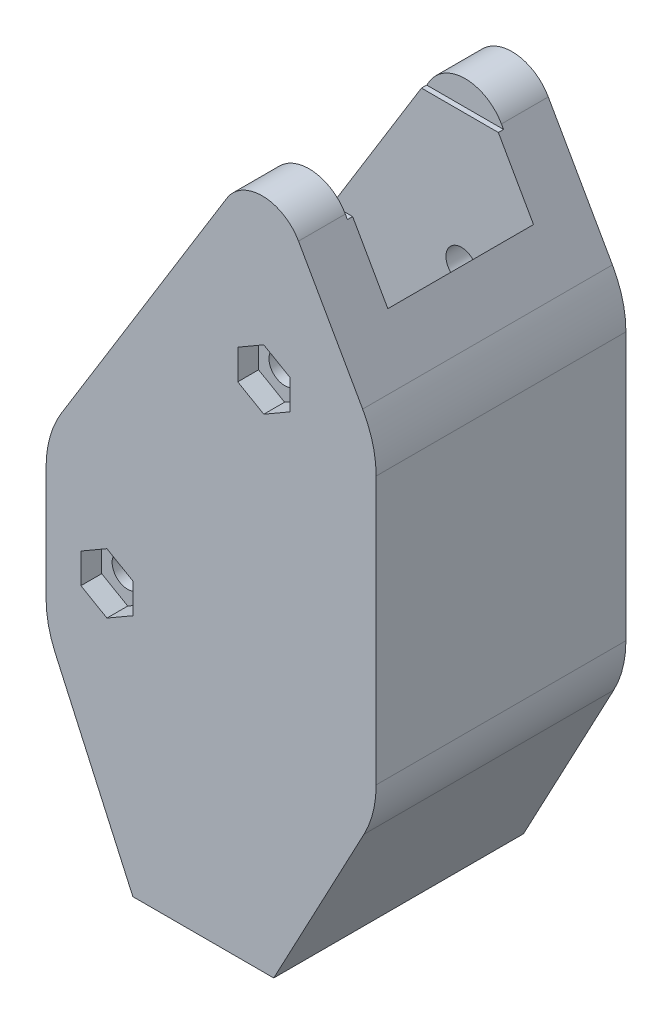
from build123d import *

# Parameters (mm, degrees)
SKETCH_1_W           = 41.838517058
SKETCH_1_H           = 61.659283987
SKETCH_1_R           = 1.5
EXTRUDE_1_DEPTH      = 24
SHELL_START          = 5
SHELL_2_OUTLINE_R    = 6.5
SHELL_2_DEPTH        = 14
SKETCH_7_W           = 14
SKETCH_7_H           = 61.659283987
CUT_EXTRUDE_2_DEPTH  = 38
SKETCH_11_W          = 14
SKETCH_11_H          = 61.659283987
EXTRUDE_2_DEPTH      = 14
SKETCH_12_W          = 10.1213772
SKETCH_12_H          = 61.659283987
CUT_EXTRUDE_3_DEPTH  = 52.896145639
CUT_EXTRUDE_5_DEPTH  = 47.819908548
SKETCH_18_W          = 15
SKETCH_18_H          = 18
CUT_EXTRUDE_6_DEPTH  = 54.011520411
EXTRUDE_5_DEPTH      = 24
SKETCH_22_W          = 27.838517058
SKETCH_22_H          = 14
CUT_EXTRUDE_8_DEPTH  = 17
SKETCH_23_W          = 14.991158549
SKETCH_23_H          = 11.73336261
EXTRUDE_8_DEPTH      = 2
FILLET_3_R           = 4
CUT_EXTRUDE_9_DEPTH  = 62.891048756
FILLET_4_R           = 4
FILLET_5_R           = 10
CUT_EXTRUDE_10_DEPTH = 2
SKETCH_26_R          = 2.5
CUT_EXTRUDE_11_DEPTH = 1


# Read off the part's stored shape, not the designer's step: 抽壳2
with BuildPart() as part:
    # 草图1 → 凸台-拉伸1 (new body)
    with BuildSketch(Plane.XY):
        with Locations((-8.896267572, -4.216675009)):
            Rectangle(SKETCH_1_W, SKETCH_1_H)
        with Locations((-8.896267572, -4.21667501)):
            Circle(SKETCH_1_R, mode=Mode.SUBTRACT)
        with Locations((6.176232993, -28.71667501)):
            Circle(SKETCH_1_R, mode=Mode.SUBTRACT)
    extrude(amount=EXTRUDE_1_DEPTH)

    # 抽壳2 outline → 抽壳2 (cut)
    # profile 1 of 2: a face of its own
    with BuildSketch(Plane.XY.offset(SHELL_START)):
        with BuildLine():
            Line((-24.815526101, 26.612966984), (-24.815526101, -35.046317003))
            Line((-24.815526101, -35.046317003), (4.697844602, -35.046317003))
            ThreePointArc((4.697844602, -35.046317003), (1.097738874, -24.659718332), (12.022990957, -25.876706469))
            Line((12.022990957, -25.876706469), (12.022990957, 26.612966984))
            Line((12.022990957, 26.612966984), (-24.815526101, 26.612966984))
        make_face()
        with Locations((-8.896267572, -4.21667501)):
            Circle(SHELL_2_OUTLINE_R, mode=Mode.SUBTRACT)
    # profile 2 of 2: a face of its own
    with BuildSketch(Plane.XY.offset(SHELL_START)):
        with BuildLine():
            ThreePointArc((12.022990957, -31.556643551), (10.23318967, -33.795169129), (7.654621384, -35.046317003))
            Line((7.654621384, -35.046317003), (12.022990957, -35.046317003))
            Line((12.022990957, -35.046317003), (12.022990957, -31.556643551))
        make_face()
    extrude(amount=SHELL_2_DEPTH, mode=Mode.SUBTRACT)

    # 草图7 → 切除-拉伸2 (cut)
    with BuildSketch(Plane(origin=(12.022990957, 0, 0), x_dir=(0, 0, -1), z_dir=(1, 0, 0))):
        with Locations((-12, -4.216675009)):
            Rectangle(SKETCH_7_W, SKETCH_7_H)
    extrude(amount=-CUT_EXTRUDE_2_DEPTH, mode=Mode.SUBTRACT)

    # 草图11 → 凸台-拉伸2 (add)
    with BuildSketch(Plane.ZY.offset(29.815526101)):
        with Locations((12, -4.216675009)):
            Rectangle(SKETCH_11_W, SKETCH_11_H)
    extrude(amount=-EXTRUDE_2_DEPTH)

    # 草图12 → 切除-拉伸3 (cut, through all)
    with BuildSketch(Plane.XY.offset(24)):
        with Locations((-24.754837501, -4.216675009)):
            Rectangle(SKETCH_12_W, SKETCH_12_H)
    extrude(amount=-CUT_EXTRUDE_3_DEPTH, mode=Mode.SUBTRACT)

    # 草图17 → 切除-拉伸5 (cut, through all)
    with BuildSketch(Plane.XY.offset(24)):
        Polygon((-8.896267572, 26.612966984), (-8.896267572, 14.867807771), (12.022990957, -19.135961659), (12.022990957, 26.612966984), align=None)
    extrude(amount=-CUT_EXTRUDE_5_DEPTH, mode=Mode.SUBTRACT)

    # 草图18 → 切除-拉伸6 (cut, through all)
    with BuildSketch(Plane.ZY.offset(19.694148901)):
        with Locations((12, 17.612966984)):
            Rectangle(SKETCH_18_W, SKETCH_18_H)
    extrude(amount=-CUT_EXTRUDE_6_DEPTH, mode=Mode.SUBTRACT)

    # 草图20 → 凸台-拉伸5 (add)
    with BuildSketch(Plane.XY.offset(24)):
        Polygon((-19.694148901, -35.046317003), (-9.853501275, -53.541034872), (3.683563025, -53.541034872), (12.022990957, -35.046317003), align=None)
    extrude(amount=-EXTRUDE_5_DEPTH)

    # 草图22 → 切除-拉伸8 (cut)
    with BuildSketch(Plane(origin=(0, -35.046317003, 0), x_dir=(1, 0, 0), z_dir=(0, 1, 0))):
        with Locations((-1.896267572, -12)):
            Rectangle(SKETCH_22_W, SKETCH_22_H)
    extrude(amount=-CUT_EXTRUDE_8_DEPTH, mode=Mode.SUBTRACT)

    # 草图23 → 凸台-拉伸8 (add)
    with BuildSketch(Plane(origin=(-29.881783728, -15.899464172, 0), x_dir=(0, 0, -1), z_dir=(0.8828123820911005, 0.469725768961675, 0))):
        with Locations((-11.904751729, -35.446570554)):
            Rectangle(SKETCH_23_W, SKETCH_23_H)
    extrude(amount=EXTRUDE_8_DEPTH)

    # 圆角3
    # the kernel refuses this fillet: 4 mm, written as the material it takes off along each edge
    with BuildSketch(Plane(origin=(-14.221722741, -41.073505124, 19), x_dir=(-0.8828123820904301, -0.4697257689629349, 0), z_dir=(0, 0, -1))) as fillet_3_piece_1:
        with BuildLine():
            CenterArc((4, -3.344189139), FILLET_3_R, 123.274953356, 56.725046644)
            Line((0, -3.344189139), (-0.08, -3.344189139))
            Line((-0.08, -3.344189139), (-0.08, 0))
            Line((-0.08, 0), (0, 0.08))
            ThreePointArc((0, 0.08), (0.902685209, 0.08), (1.761477827, 0.066883783))
            Line((1.761477827, 0.066883783), (1.805370419, 0))
        make_face()
    extrude(amount=14, mode=Mode.SUBTRACT)

    # 草图24 → 切除-拉伸9 (cut, through all)
    with BuildSketch(Plane(origin=(0, 0, 0), x_dir=(-1, 0, 0), z_dir=(0, 0, -1))):
        Polygon((8.896267572, 14.867807771), (19.694148901, -4.21667501), (19.694148901, 26.612966984), (8.896267572, 26.612966984), align=None)
    extrude(amount=-CUT_EXTRUDE_9_DEPTH, mode=Mode.SUBTRACT)

    # 圆角4
    fillet_4_edges = [part.edges().sort_by_distance(p)[0] for p in [
        (-8.896267572, 14.867807771, 2.25),
        (-8.896267572, 14.867807771, 21.75),
    ]]
    fillet(fillet_4_edges, radius=FILLET_4_R)

    # 圆角5
    fillet_5_edges = [part.edges().sort_by_distance(p)[0] for p in [
        (-19.694148901, -35.046317003, 12),
        (12.022990957, -19.135961659, 2.5),
        (12.022990957, -19.135961659, 21.5),
        (12.022990957, -35.046317003, 2.5),
        (-19.694148901, -4.21667501, 12),
        (12.022990957, -35.046317003, 21.5),
    ]]
    fillet(fillet_5_edges, radius=FILLET_5_R)

    # 草图25 → 切除-拉伸10 (cut)
    with BuildSketch(Plane.XY.offset(24)):
        Polygon((-8.896267572, -7.103426356), (-6.396267572, -5.660050683), (-6.396267572, -2.773299337), (-8.896267572, -1.329923664), (-11.396267572, -2.773299337), (-11.396267572, -5.660050683), align=None)
        Polygon((6.176232993, -25.829923664), (3.676232993, -27.273299337), (3.676232993, -30.160050683), (6.176232993, -31.603426356), (8.676232993, -30.160050683), (8.676232993, -27.273299337), align=None)
    extrude(amount=-CUT_EXTRUDE_10_DEPTH, mode=Mode.SUBTRACT)

    # 草图26 → 切除-拉伸11 (cut)
    with BuildSketch(Plane(origin=(0, 0, 0), x_dir=(-1, 0, 0), z_dir=(0, 0, -1))):
        with Locations((8.896267572, -4.21667501)):
            Circle(SKETCH_26_R)
        with Locations((-6.176232993, -28.71667501)):
            Circle(SKETCH_26_R)
    extrude(amount=-CUT_EXTRUDE_11_DEPTH, mode=Mode.SUBTRACT)


with BuildPart() as body_2:
    # 镜向1: mirrored copy
    add(part.part.mirror(Plane.ZY.offset(29.694148901)))


solid = body_2.part
